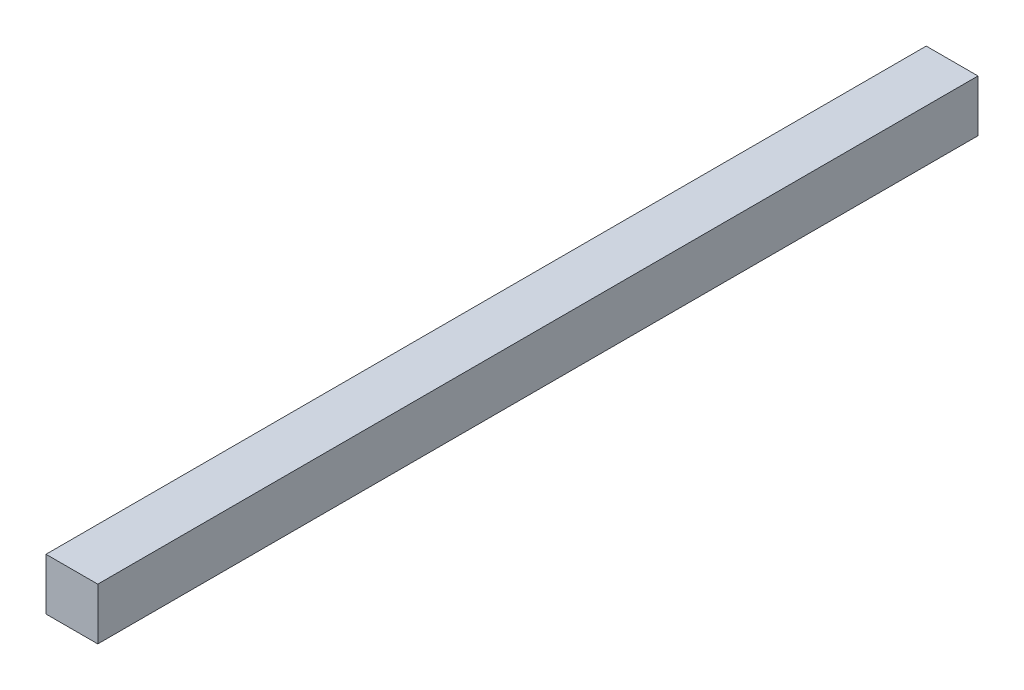
from build123d import *

# Parameters (mm, degrees)
ESQUISSE1_W        = 10
ESQUISSE1_H        = 10
BOSS_EXTRU_1_DEPTH = 85


with BuildPart() as part:
    # Esquisse1 → Boss.-Extru.1 (new, symmetric)
    with BuildSketch(Plane.XY):
        Rectangle(ESQUISSE1_W, ESQUISSE1_H)
    extrude(amount=BOSS_EXTRU_1_DEPTH, both=True)


solid = part.part
